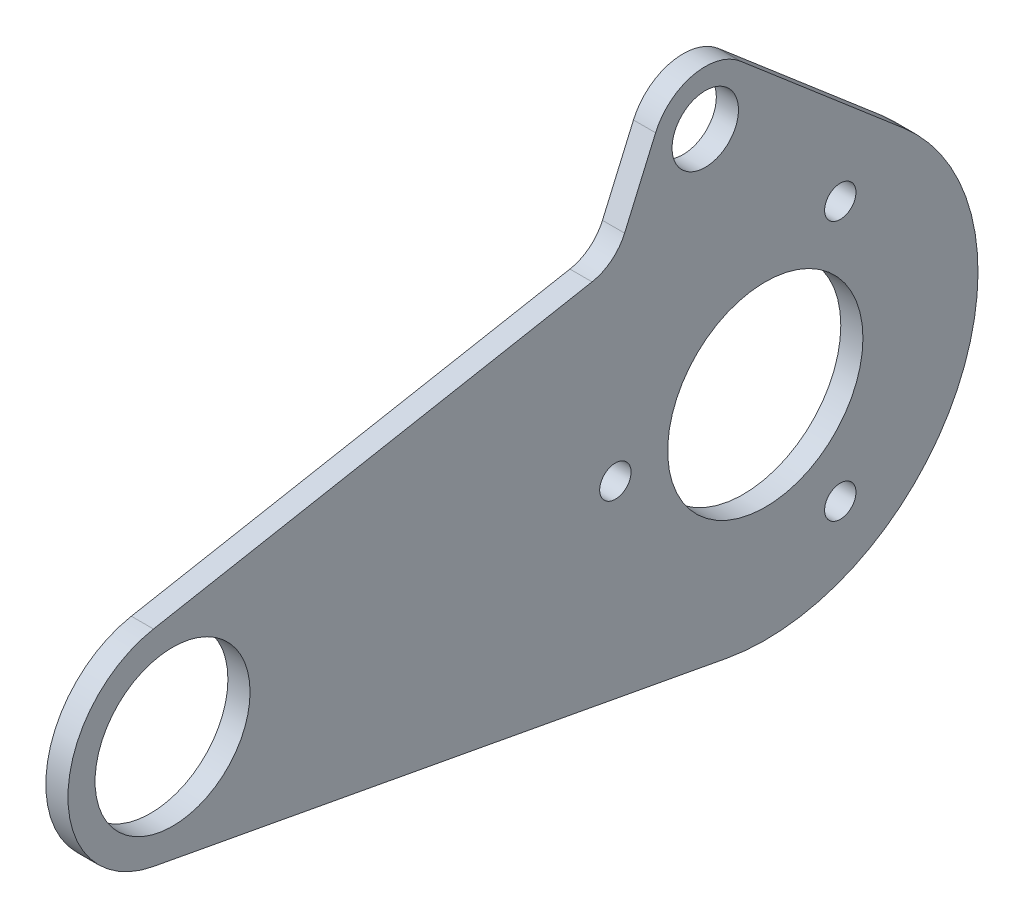
from build123d import *

# Parameters (mm, degrees)
SKETCH1_R            = 14
SKETCH1_R_2          = 11.1125
SKETCH1_R_3          = 4.7625
BOSS_EXTRUDE1_DEPTH  = 1.5875
M4_CLEARANCE_HOLE1_D = 4.5
FILLET1_R            = 6.35


with BuildPart() as part:
    # Sketch1 → Boss-Extrude1 (new, symmetric)
    with BuildSketch(Plane(origin=(0, 0, 0), x_dir=(0, 0, -1), z_dir=(1, 0, 0))):
        with BuildLine():
            Line((104.821761092, 23.180763301), (81.432924752, 43.180446665))
            ThreePointArc((81.432924752, 43.180446665), (74.640990809, 44.844080474), (69.266854659, 40.370077256))
            Line((69.266854659, 40.370077256), (63.479189398, 27.028805119))
            Line((63.479189398, 27.028805119), (-2.735294118, 14.748497079))
            ThreePointArc((-2.735294118, 14.748497079), (-15, 0), (-2.735294118, -14.748497079))
            Line((-2.735294118, -14.748497079), (79.438235294, -29.988610727))
            ThreePointArc((79.438235294, -29.988610727), (112.524215845, -13.140302209), (104.821761092, 23.180763301))
        make_face()
        with Locations((85, 0)):
            Circle(SKETCH1_R, mode=Mode.SUBTRACT)
        Circle(SKETCH1_R_2, mode=Mode.SUBTRACT)
        with Locations((76.388124081, 37.280752399)):
            Circle(SKETCH1_R_3, mode=Mode.SUBTRACT)
    extrude(amount=BOSS_EXTRUDE1_DEPTH, both=True)

    # M4 Clearance Hole1 (through all)
    with Locations(Plane(origin=(1.5875, 0, 0), x_dir=(0, 0, -1), z_dir=(1, 0, 0))):
        with Locations((63.5, 0), (95.75, 18.619546181), (95.75, -18.619546181)):
            Hole(M4_CLEARANCE_HOLE1_D / 2)

    # Fillet1
    fillet1_edges = [part.edges().sort_by_distance(p)[0] for p in [
        (0, 27.028805119, -63.479189398),
    ]]
    fillet(fillet1_edges, radius=FILLET1_R)


solid = part.part
